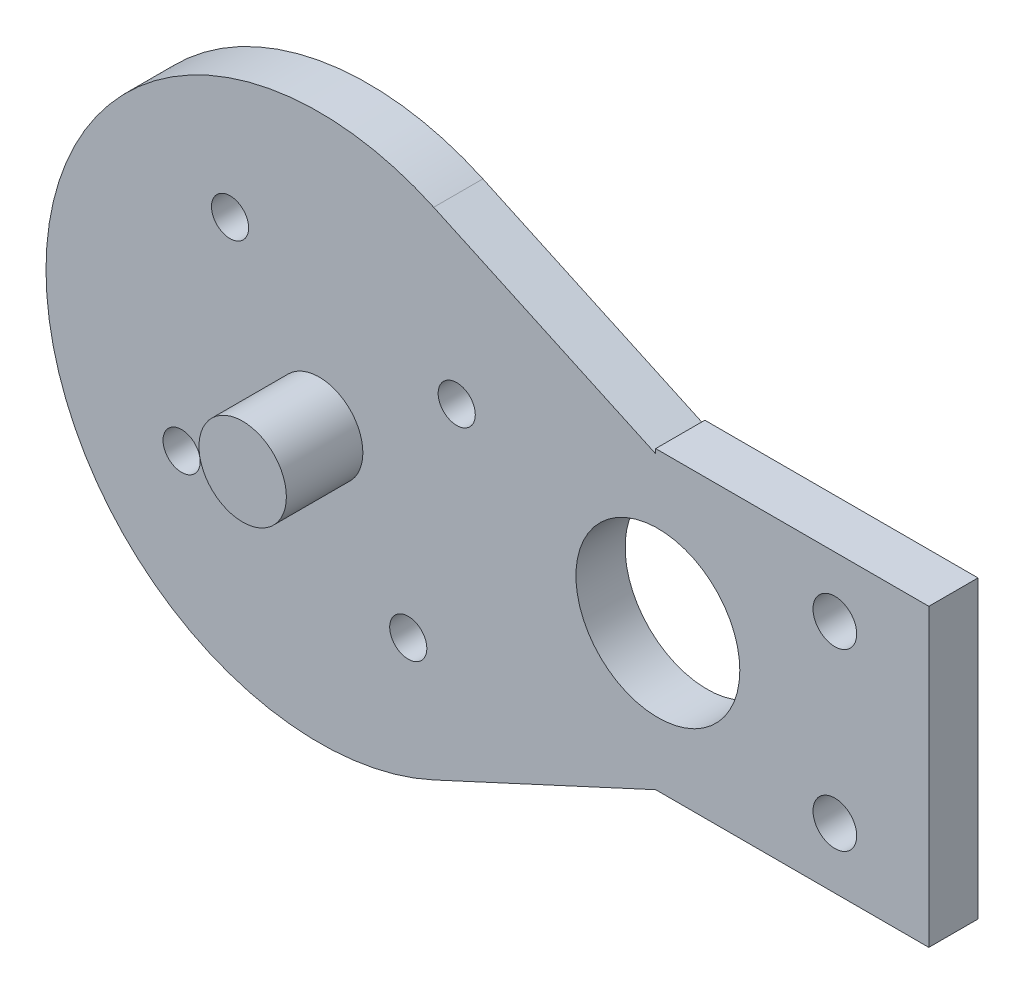
from build123d import *

# Parameters (mm, degrees)
BOSS_EXTRUDE1_DEPTH = 4.5
SKETCH2_R           = 7.5
CUT_EXTRUDE1_DEPTH  = 50.942466899
SKETCH3_R           = 4
BOSS_EXTRUDE2_DEPTH = 7
BOSS_EXTRUDE3_DEPTH = 4.5
FILLET1_R           = 10
CUT_EXTRUDE4_DEPTH  = 62.754464971
SKETCH9_R           = 1
CUT_EXTRUDE5_DEPTH  = 62.182594482
SKETCH10_R          = 1.7
CUT_EXTRUDE6_DEPTH  = 2.4
CUT_EXTRUDE7_DEPTH  = 4.5
FILLET2_R           = 10
CUT_EXTRUDE8_DEPTH  = 51.658168147
SKETCH20_R          = 1
BOSS_EXTRUDE4_DEPTH = 4.5
SKETCH21_R          = 2
CUT_EXTRUDE9_DEPTH  = 3


with BuildPart() as part:
    # Sketch1 → Boss-Extrude1 (new body)
    with BuildSketch(Plane.XY):
        with BuildLine():
            Line((10.483870968, 22.695560128), (36.032258065, 10.893868862))
            ThreePointArc((36.032258065, 10.893868862), (43, 0), (36.032258065, -10.893868862))
            Line((36.032258065, -10.893868862), (10.483870968, -22.695560128))
            ThreePointArc((10.483870968, -22.695560128), (-25, 0), (10.483870968, 22.695560128))
        make_face()
    extrude(amount=BOSS_EXTRUDE1_DEPTH)

    # Sketch2 → Cut-Extrude1 (cut, through all)
    with BuildSketch(Plane.XY.offset(4.5)):
        with Locations((31, 0)):
            Circle(SKETCH2_R)
    extrude(amount=-CUT_EXTRUDE1_DEPTH, mode=Mode.SUBTRACT)

    # Sketch3 → Boss-Extrude2 (add)
    with BuildSketch(Plane.XY.offset(4.5)):
        Circle(SKETCH3_R)
    extrude(amount=BOSS_EXTRUDE2_DEPTH)

    # Sketch4 → Boss-Extrude3 (add)
    with BuildSketch(Plane(origin=(0, 0, 0), x_dir=(-1, 0, 0), z_dir=(0, 0, -1))):
        with BuildLine():
            Line((-36.032258065, 10.893868862), (-56.032258065, 10.893868862))
            Line((-56.032258065, 10.893868862), (-56.032258065, -10.893868862))
            Line((-56.032258065, -10.893868862), (-36.032258065, -10.893868862))
            ThreePointArc((-36.032258065, -10.893868862), (-43, 0), (-36.032258065, 10.893868862))
        make_face()
        with BuildLine():
            Line((22.501635968, 10.893868862), (42.501635968, 10.893868862))
            Line((42.501635968, 10.893868862), (42.501635968, -10.893868862))
            Line((42.501635968, -10.893868862), (22.501635968, -10.893868862))
            ThreePointArc((22.501635968, -10.893868862), (25, 0), (22.501635968, 10.893868862))
        make_face()
    extrude(amount=-BOSS_EXTRUDE3_DEPTH)

    # Fillet1
    fillet1_edges = [part.edges().sort_by_distance(p)[0] for p in [
        (56.032258065, 10.893868862, 2.25),
        (56.032258065, -10.893868862, 2.25),
        (-42.501635968, -10.893868862, 2.25),
        (-42.501635968, 10.893868862, 2.25),
    ]]
    fillet(fillet1_edges, radius=FILLET1_R)

    # Sketch8 → Cut-Extrude4 (cut, through all)
    with BuildSketch(Plane.XY.offset(4.5)):
        with BuildLine():
            Line((56.032258065, 0.893868862), (56.032258065, -0.893868862))
            ThreePointArc((56.032258065, -0.893868862), (55.873267798, -2.669967796), (55.401352579, -4.389590243))
            Line((55.401352579, -4.389590243), (55.401352579, 4.389590243))
            ThreePointArc((55.401352579, 4.389590243), (55.873267798, 2.669967796), (56.032258065, 0.893868862))
        make_face()
        with BuildLine():
            Line((-42.501635968, -0.893868862), (-42.501635968, 0.893868862))
            ThreePointArc((-42.501635968, 0.893868862), (-42.342645701, 2.669967796), (-41.870730482, 4.389590243))
            Line((-41.870730482, 4.389590243), (-41.870730482, -4.389590243))
            ThreePointArc((-41.870730482, -4.389590243), (-42.342645701, -2.669967796), (-42.501635968, -0.893868862))
        make_face()
    extrude(amount=-CUT_EXTRUDE4_DEPTH, mode=Mode.SUBTRACT)

    # Sketch9 → Cut-Extrude5 (cut, through all)
    with BuildSketch(Plane.XY.offset(4.5)):
        with Locations((-8.154330676, 12.589951995)):
            Circle(SKETCH9_R)
        with Locations((12.589951995, 8.154330676)):
            Circle(SKETCH9_R)
        with Locations((8.154330676, -12.589951995)):
            Circle(SKETCH9_R)
        with Locations((-12.589951995, -8.154330676)):
            Circle(SKETCH9_R)
    extrude(amount=-CUT_EXTRUDE5_DEPTH, mode=Mode.SUBTRACT)

    # Sketch10 → Cut-Extrude6 (cut)
    with BuildSketch(Plane.XY.offset(4.5)):
        with Locations((-8.154330676, 12.589951995)):
            Circle(SKETCH10_R)
        with Locations((12.589951995, 8.154330676)):
            Circle(SKETCH10_R)
        with Locations((8.154330676, -12.589951995)):
            Circle(SKETCH10_R)
        with Locations((-12.589951995, -8.154330676)):
            Circle(SKETCH10_R)
    extrude(amount=-CUT_EXTRUDE6_DEPTH, mode=Mode.SUBTRACT)

    # Sketch11 → Cut-Extrude7 (cut)
    with BuildSketch(Plane(origin=(0, 0, 0), x_dir=(-1, 0, 0), z_dir=(0, 0, -1))):
        with BuildLine():
            Line((-40.960235838, 14.646128502), (-73.67178465, 18.9155259))
            Line((-73.67178465, 18.9155259), (-68.640309048, -15.675868866))
            Line((-68.640309048, -15.675868866), (-41.444996676, -13.212200821))
            ThreePointArc((-41.444996676, -13.212200821), (-43.493415761, 0.756825882), (-40.960235838, 14.646128502))
        make_face()
    extrude(amount=-CUT_EXTRUDE7_DEPTH, mode=Mode.SUBTRACT)

    # Fillet2
    # the kernel refuses this fillet: 10 mm, written as the material it takes off along each edge
    with BuildSketch(Plane(origin=(42.113817462, -10.893868862, 28.001897109), x_dir=(0.1443560651040101, 0.9895258088941827, 0), z_dir=(0, 0, -1))) as fillet2_piece_1:
        with BuildLine():
            CenterArc((8.32021185, -9.941449502), FILLET2_R, 83.796810377, 73.10182949)
            Line((-0.877909984, -6.017859982), (-1.061872421, -5.939388192))
            ThreePointArc((-1.061872421, -5.939388192), (-0.636860154, -2.980058778), (-0.197905162, 0.028871213))
            Line((-0.197905162, 0.028871213), (-0.02161094, 0.19882899))
            ThreePointArc((-0.02161094, 0.19882899), (4.700379422, 0.454694668), (9.422369784, 0.19882899))
            Line((9.422369784, 0.19882899), (9.400758844, 0))
        make_face()
    extrude(amount=51.503794219, mode=Mode.SUBTRACT)
    with BuildSketch(Plane(origin=(42.113817462, 10.893868862, 28.001897109), x_dir=(-1, 0, 0), z_dir=(0, 0, -1))) as fillet2_piece_2:
        with BuildLine():
            CenterArc((8.636247816, -9.668172893), FILLET2_R, 104.801368002, 73.10182949)
            Line((-1.357056556, -9.302293499), (-1.556922643, -9.294975911))
            ThreePointArc((-1.556922643, -9.294975911), (-1.128460387, -4.585508816), (-0.193626747, 0.050086753))
            Line((-0.193626747, 0.050086753), (0, 0.2))
            ThreePointArc((0, 0.2), (3.040779699, 0.2), (6.030465629, 0.193363458))
            Line((6.030465629, 0.193363458), (6.081559398, 0))
        make_face()
    extrude(amount=51.503794219, mode=Mode.SUBTRACT)

    # Sketch12 → Cut-Extrude8 (cut, through all)
    with BuildSketch(Plane.XY.offset(4.5)):
        with BuildLine():
            Line((-22.501635968, 10.893868862), (-42.592674389, 14.819498464))
            Line((-42.592674389, 14.819498464), (-48.148078041, -13.612584929))
            Line((-48.148078041, -13.612584929), (-27.427309778, -14.315310761))
            Line((-27.427309778, -14.315310761), (-22.501635968, -10.893868862))
            ThreePointArc((-22.501635968, -10.893868862), (-25, 0), (-22.501635968, 10.893868862))
        make_face()
    extrude(amount=-CUT_EXTRUDE8_DEPTH, mode=Mode.SUBTRACT)

    # Sketch20 → Boss-Extrude4 (add)
    with BuildSketch(Plane.XY.offset(4.5)):
        with BuildLine():
            Line((55.798644786, -13.311457412), (55.798644786, 13.726073795))
            Line((55.798644786, 13.726073795), (30.798644786, 13.726073795))
            Line((30.798644786, 13.726073795), (30.798644786, 13.311457412))
            Line((30.798644786, 13.311457412), (36.032258065, 10.893868862))
            ThreePointArc((36.032258065, 10.893868862), (41.287575846, 7.470998455), (43.470874018, 1.591575362))
            ThreePointArc((43.470874018, 1.591575362), (43.5, 0), (43.470874018, -1.591575362))
            ThreePointArc((43.470874018, -1.591575362), (41.287575846, -7.470998455), (36.032258065, -10.893868862))
            Line((36.032258065, -10.893868862), (30.798644786, -13.311457412))
            Line((30.798644786, -13.311457412), (55.798644786, -13.311457412))
        make_face()
        with Locations((47.197816856, -7.773648876)):
            Circle(SKETCH20_R, mode=Mode.SUBTRACT)
        with Locations((47.197816856, 8.226351124)):
            Circle(SKETCH20_R, mode=Mode.SUBTRACT)
    extrude(amount=-BOSS_EXTRUDE4_DEPTH)

    # Sketch21 → Cut-Extrude9 (cut)
    with BuildSketch(Plane.XY.offset(4.5)):
        with Locations((47.197816856, 8.226351124)):
            Circle(SKETCH21_R)
        with Locations((47.197816856, -7.773648876)):
            Circle(SKETCH21_R)
    extrude(amount=-CUT_EXTRUDE9_DEPTH, mode=Mode.SUBTRACT)


solid = part.part
